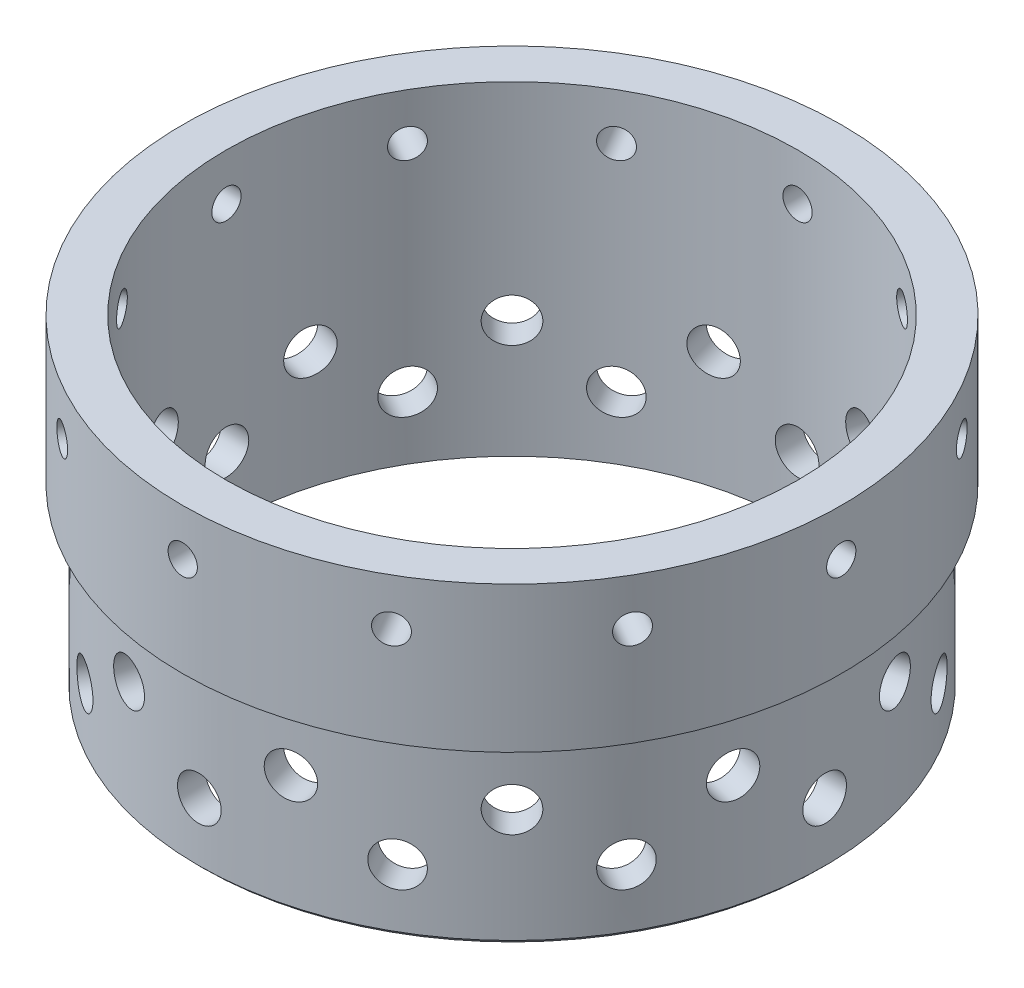
from build123d import *

# Parameters (mm, degrees)
SKETCH1_R           = 76.1238
SKETCH1_R_2         = 66.04
BOSS_EXTRUDE1_DEPTH = 12.7
BOSS_EXTRUDE2_START = -41.275
SKETCH1_3_R         = 72.39
SKETCH1_3_R_2       = 66.04
BOSS_EXTRUDE2_DEPTH = 41.275
SKETCH1_4_R         = 76.1238
SKETCH1_4_R_2       = 66.04
BOSS_EXTRUDE3_DEPTH = 33.655
CHAMFER1_SIZE       = 1
SKETCH2_R           = 5.0419
CUT_EXTRUDE1_DEPTH  = 116.296537146
SKETCH3_R           = 5.0419
CUT_EXTRUDE2_DEPTH  = 38.1
CIRPATTERN2_COUNT   = 12
SKETCH2_3_R         = 3.3782
CUT_EXTRUDE3_DEPTH  = 116.296537182
CIRPATTERN3_COUNT   = 12
FILLET1_R           = 0.4064


with BuildPart() as part:
    # Sketch1 → Boss-Extrude1 (new body)
    with BuildSketch(Plane(origin=(0, 0, 0), x_dir=(1, 0, 0), z_dir=(0, 1, 0))):
        Circle(SKETCH1_R)
        Circle(SKETCH1_R_2, mode=Mode.SUBTRACT)
    extrude(amount=BOSS_EXTRUDE1_DEPTH)

    # Sketch1<3> → Boss-Extrude2 (add)
    with BuildSketch(Plane(origin=(0, 0, 0), x_dir=(1, 0, 0), z_dir=(0, 1, 0)).offset(BOSS_EXTRUDE2_START)):
        Circle(SKETCH1_3_R)
        Circle(SKETCH1_3_R_2, mode=Mode.SUBTRACT)
    extrude(amount=BOSS_EXTRUDE2_DEPTH)

    # Sketch1<4> → Boss-Extrude3 (add)
    with BuildSketch(Plane(origin=(0, 0, 0), x_dir=(1, 0, 0), z_dir=(0, 1, 0))):
        Circle(SKETCH1_4_R)
        Circle(SKETCH1_4_R_2, mode=Mode.SUBTRACT)
    extrude(amount=BOSS_EXTRUDE3_DEPTH)

    # Chamfer1
    chamfer1_edges = [part.edges().sort_by_distance(p)[0] for p in [
        (-72.39, -41.275, 0),
    ]]
    chamfer(chamfer1_edges, length=CHAMFER1_SIZE)

    # Sketch2 → Cut-Extrude1 (cut, through all)
    with BuildSketch(Plane.XY):
        with Locations((0, -26.797)):
            Circle(SKETCH2_R)
    cut_extrude1 = extrude(amount=-CUT_EXTRUDE1_DEPTH, mode=Mode.SUBTRACT)

    # Sketch3 → Cut-Extrude2 (cut)
    with BuildSketch(Plane(origin=(-19.702289226, 0, 73.529944415), x_dir=(0, -1, 0), z_dir=(-0.25881904510252135, 0, 0.9659258262890681))):
        with Locations((14.097, 0)):
            Circle(SKETCH3_R)
    cut_extrude2 = extrude(amount=-CUT_EXTRUDE2_DEPTH, mode=Mode.SUBTRACT)

    # CirPattern2: Cut-Extrude1, Cut-Extrude2 ×12 about axis
    cirpattern2_axis = Axis((0, 12.7, 0), (0, -1, 0))
    add([cut_extrude1.rotate(cirpattern2_axis, i * 360 / CIRPATTERN2_COUNT) for i in range(1, CIRPATTERN2_COUNT)], mode=Mode.SUBTRACT)
    add([cut_extrude2.rotate(cirpattern2_axis, i * 360 / CIRPATTERN2_COUNT) for i in range(1, CIRPATTERN2_COUNT)], mode=Mode.SUBTRACT)

    # Sketch2<3> → Cut-Extrude3 (cut, through all)
    with BuildSketch(Plane.XY):
        with Locations((0, 22.86)):
            Circle(SKETCH2_3_R)
    cut_extrude3 = extrude(amount=-CUT_EXTRUDE3_DEPTH, mode=Mode.SUBTRACT)

    # CirPattern3: Cut-Extrude3 ×12 about axis
    cirpattern3_axis = Axis((0, 12.7, 0), (0, -1, 0))
    for i in range(1, CIRPATTERN3_COUNT):
        add(cut_extrude3.rotate(cirpattern3_axis, i * 360 / CIRPATTERN3_COUNT), mode=Mode.SUBTRACT)

    # Fillet1
    fillet1_edges = [part.edges().sort_by_distance(p)[0] for p in [
        (-72.39, 0, 0),
    ]]
    fillet(fillet1_edges, radius=FILLET1_R)


solid = part.part
